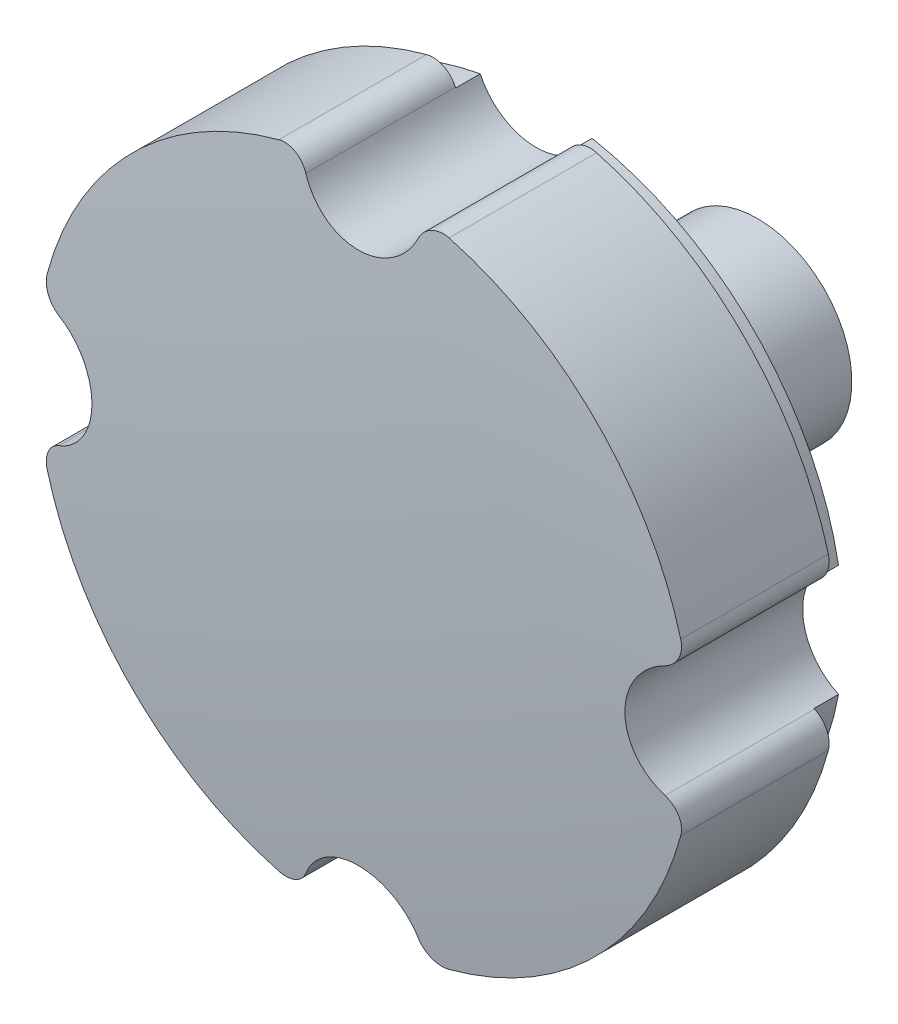
from build123d import *

# Parameters (mm, degrees)
CUT_EXTRUDE1_REACH = 77.502
SKETCH2_R          = 7.5
FILLET1_R          = 3


with BuildPart() as part:
    # Sketch1 → Revolve1 (revolve)
    with BuildSketch(Plane(origin=(0, 0, 0), x_dir=(1, 0, 0), z_dir=(0, 1, 0))):
        with BuildLine():
            Line((0, 20.005025157), (0, 0))
            ThreePointArc((0, 0), (-20.025110024, 0.501570756), (-40, 2.005025157))
            Line((-40, 2.005025157), (-40, 20.005025157))
            Line((-40, 20.005025157), (-37.5, 20.005025157))
            Line((-37.5, 20.005025157), (-37.5, 23.005025157))
            Line((-37.5, 23.005025157), (-11.5, 23.005025157))
            Line((-11.5, 23.005025157), (-11.5, 50.005025157))
            Line((-11.5, 50.005025157), (-6, 50.005025157))
            Line((-6, 50.005025157), (-6, 20.005025157))
            Line((-6, 20.005025157), (0, 20.005025157))
        make_face()
    revolve(axis=Axis((0, 0, -358.843484937), (0, 0, 1)))

    # Sketch2 → Cut-Extrude1 (cut, up to next)
    with BuildSketch(Plane.XY, mode=Mode.PRIVATE) as cut_extrude1_sk1:
        with Locations((0, 40)):
            Circle(SKETCH2_R)
    cut_extrude1_tool1 = extrude(cut_extrude1_sk1.sketch, amount=-CUT_EXTRUDE1_REACH, mode=Mode.PRIVATE) & part.part
    # Sketch2 → Cut-Extrude1 (cut, up to next)
    with BuildSketch(Plane.XY, mode=Mode.PRIVATE) as cut_extrude1_sk2:
        with Locations((40, 0)):
            Circle(SKETCH2_R)
    cut_extrude1_tool2 = extrude(cut_extrude1_sk2.sketch, amount=-CUT_EXTRUDE1_REACH, mode=Mode.PRIVATE) & part.part
    # Sketch2 → Cut-Extrude1 (cut, up to next)
    with BuildSketch(Plane.XY, mode=Mode.PRIVATE) as cut_extrude1_sk3:
        with Locations((0, -40)):
            Circle(SKETCH2_R)
    cut_extrude1_tool3 = extrude(cut_extrude1_sk3.sketch, amount=-CUT_EXTRUDE1_REACH, mode=Mode.PRIVATE) & part.part
    # Sketch2 → Cut-Extrude1 (cut, up to next)
    with BuildSketch(Plane.XY, mode=Mode.PRIVATE) as cut_extrude1_sk4:
        with Locations((-40, 0)):
            Circle(SKETCH2_R)
    cut_extrude1_tool4 = extrude(cut_extrude1_sk4.sketch, amount=-CUT_EXTRUDE1_REACH, mode=Mode.PRIVATE) & part.part
    add(cut_extrude1_tool1.solids().sort_by_distance((0, 40, 0))[0], mode=Mode.SUBTRACT)
    add(cut_extrude1_tool2.solids().sort_by_distance((40, 0, 0))[0], mode=Mode.SUBTRACT)
    add(cut_extrude1_tool3.solids().sort_by_distance((0, -40, 0))[0], mode=Mode.SUBTRACT)
    add(cut_extrude1_tool4.solids().sort_by_distance((-40, 0, 0))[0], mode=Mode.SUBTRACT)

    # Fillet1
    # the kernel refuses this fillet: 3 mm, written as the material it takes off along each edge
    with BuildSketch(Plane(origin=(-39.296875, -7.466968276, -27.456580588), x_dir=(0.9673809008255011, 0.25332625745872106, 0), z_dir=(0, 0, 1))) as fillet1_piece_1:
        with BuildLine():
            CenterArc((2.907334637, -2.960609009), FILLET1_R, 99.295051663, 81.059690814)
            ThreePointArc((-0.092607863, -2.979183163), (-0.074063004, -1.488728691), (0, 0))
            ThreePointArc((0, 0), (1.211389432, -0.098477478), (2.422778864, 0))
        make_face()
    extrude(amount=32.903111461, mode=Mode.SUBTRACT)
    with BuildSketch(Plane(origin=(-39.296875, 7.466968276, -27.456580588), x_dir=(0.967380900825501, -0.25332625745872067, 0), z_dir=(0, 0, 1))) as fillet1_piece_2:
        with BuildLine():
            CenterArc((2.907334637, 2.960609009), FILLET1_R, 179.645257523, 81.059690814)
            ThreePointArc((-0.092607863, 2.979183163), (-0.074063004, 1.488728691), (0, 0))
            ThreePointArc((0, 0), (1.211389432, 0.098477478), (2.422778864, 0))
        make_face()
    extrude(amount=32.903110861, mode=Mode.SUBTRACT)
    with BuildSketch(Plane(origin=(7.466968276, -39.296875, -27.456580588), x_dir=(-0.2533262574587217, 0.9673809008255008, 0), z_dir=(0, 0, 1)), Plane(origin=(39.296875, 7.466968276, -27.456580588), x_dir=(-0.9673809008255009, -0.25332625745872134, 0), z_dir=(0, 0, 1)), Plane(origin=(-7.466968276, 39.296875, -27.456580588), x_dir=(0.2533262574587217, -0.9673809008255008, 0), z_dir=(0, 0, 1))) as fillet1_piece_3:
        with BuildLine():
            CenterArc((2.907334637, -2.960609009), FILLET1_R, 99.295051663, 81.059690814)
            ThreePointArc((-0.092607863, -2.979183163), (-0.074063004, -1.488728691), (0, 0))
            ThreePointArc((0, 0), (1.211389432, -0.098477478), (2.422778864, 0))
        make_face()
    extrude(amount=32.903110861, mode=Mode.SUBTRACT)
    with BuildSketch(Plane(origin=(-7.466968276, -39.296875, -27.456580588), x_dir=(-0.974784701688693, 0.22314745204390218, 0), z_dir=(0, 0, 1)), Plane(origin=(39.296875, -7.466968276, -27.456580588), x_dir=(-0.2231474520439016, -0.9747847016886931, 0), z_dir=(0, 0, 1)), Plane(origin=(7.466968276, 39.296875, -27.456580588), x_dir=(0.9747847016886936, -0.22314745204390027, 0), z_dir=(0, 0, 1))) as fillet1_piece_4:
        with BuildLine():
            CenterArc((2.868848841, -2.997917064), FILLET1_R, 87.864792425, 81.059690814)
            ThreePointArc((-0.075275684, -2.421609175), (0.060792092, -1.21386428), (0, 0))
            ThreePointArc((0, 0), (1.490311086, 0.027772481), (2.980622172, 0))
        make_face()
    extrude(amount=32.903110861, mode=Mode.SUBTRACT)


solid = part.part
